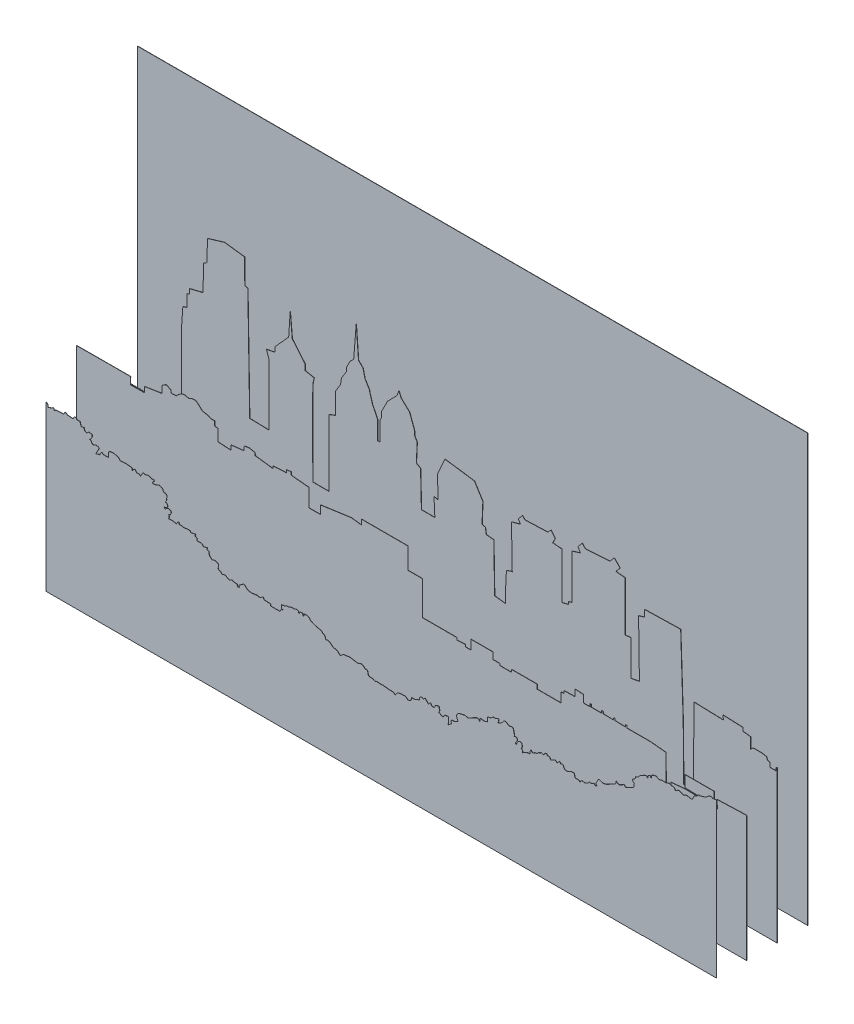
from build123d import *

# Parameters (mm, degrees)
SKETCH5_W           = 279.4
SKETCH5_H           = 177.800683396
BOSS_EXTRUDE1_DEPTH = 0.100000054
BOSS_EXTRUDE2_DEPTH = 0.100000054
BOSS_EXTRUDE3_DEPTH = 0.100000054
BOSS_EXTRUDE4_DEPTH = 0.100000054


with BuildPart() as part:
    # Sketch5 → Boss-Extrude1 (new body)
    with BuildSketch(Plane.XY):
        with Locations((139.7, -88.900341698)):
            Rectangle(SKETCH5_W, SKETCH5_H)
    extrude(amount=BOSS_EXTRUDE1_DEPTH)


with BuildPart() as body_2:
    # Sketch2 → Boss-Extrude2 (new body)
    with BuildSketch(Plane.XY.offset(12.7)):
        with BuildLine():
            Line((279.4, -114.534072706), (278.809769016, -114.829381985))
            Line((278.809769016, -114.829381985), (278.809769016, -115.882870653))
            Line((278.809769016, -115.882870653), (276.353092957, -115.882870653))
            Line((276.353092957, -115.882870653), (276.353092957, -114.127056207))
            Line((276.353092957, -114.127056207), (275.300250244, -113.775871785))
            Line((275.300250244, -113.775871785), (274.949302673, -112.72240465))
            Line((274.949302673, -112.72240465), (272.843574185, -112.371220228))
            Line((272.843574185, -112.371220228), (269.334120009, -112.371220228))
            Line((269.334120009, -112.371220228), (268.281255764, -113.424708896))
            Line((268.281255764, -113.424708896), (268.281255764, -108.859591336))
            Line((268.281255764, -108.859591336), (265.122684564, -108.508449978))
            Line((265.122684564, -108.508449978), (265.122684564, -107.103798421))
            Line((265.122684564, -107.103798421), (256.699899801, -106.752635532))
            Line((256.699899801, -106.752635532), (257.050847371, -108.508449978))
            Line((257.050847371, -108.508449978), (244.651388889, -108.126388889))
            Line((244.651388889, -108.126388889), (244.545559862, -139.876388889))
            Line((244.545559862, -139.876388889), (240.418055556, -140.088046943))
            Line((240.418055556, -140.088046943), (240.205256314, -117.28752221))
            Line((240.205256314, -117.28752221), (239.152413601, -84.629308912))
            Line((239.152413601, -84.629308912), (224.06158193, -84.98045027))
            Line((224.06158193, -84.98045027), (224.06158193, -87.789774916))
            Line((224.06158193, -87.789774916), (221.60490587, -88.492122226))
            Line((221.60490587, -88.492122226), (221.955853441, -112.020057339))
            Line((221.955853441, -112.020057339), (218.446334669, -112.72240465))
            Line((218.446334669, -112.72240465), (218.446334669, -97.973520237))
            Line((218.446334669, -97.973520237), (215.989744737, -98.324704658))
            Line((215.989744737, -98.324704658), (215.989744737, -77.606029595))
            Line((215.989744737, -77.606029595), (212.129256863, -77.254866706))
            Line((212.129256863, -77.254866706), (213.884016249, -75.147867839))
            Line((213.884016249, -75.147867839), (211.427361721, -72.689727614))
            Line((211.427361721, -72.689727614), (209.672623867, -74.796726481))
            Line((209.672623867, -74.796726481), (199.495058187, -75.499073792))
            Line((199.495058187, -75.499073792), (198.091289435, -74.094379171))
            Line((198.091289435, -74.094379171), (196.33653005, -76.201378038))
            Line((196.33653005, -76.201378038), (197.389394294, -77.957192485))
            Line((197.389394294, -77.957192485), (193.879897054, -79.010681152))
            Line((193.879897054, -79.010681152), (193.879897054, -97.622357347))
            Line((193.879897054, -97.622357347), (192.476085239, -97.973520237))
            Line((192.476085239, -97.973520237), (192.476085239, -99.027008904))
            Line((192.476085239, -99.027008904), (189.668504673, -99.729356215))
            Line((189.668504673, -99.729356215), (189.668504673, -80.415332709))
            Line((189.668504673, -80.415332709), (185.808059862, -80.064191352))
            Line((185.808059862, -80.064191352), (186.860881042, -77.957192485))
            Line((186.860881042, -77.957192485), (185.106121657, -75.850215149))
            Line((185.106121657, -75.850215149), (183.702309842, -77.254866706))
            Line((183.702309842, -77.254866706), (174.226682366, -77.606029595))
            Line((174.226682366, -77.606029595), (173.173839654, -76.552519396))
            Line((173.173839654, -76.552519396), (171.4191018, -78.659518263))
            Line((171.4191018, -78.659518263), (172.47192298, -80.064191352))
            Line((172.47192298, -80.064191352), (168.611499702, -81.117658488))
            add(Edge.make_bspline(
                [(168.611499702, -81.117658488), (168.816978116, -97.961354743), (168.947116597, -98.979897224)],
                knots=[50, 50, 50, 51, 51, 51], degree=2))
            add(Edge.make_bspline(
                [(168.947116597, -98.979897224), (168.731475152, -98.850275506), (166.505771213, -99.729356215)],
                knots=[53, 53, 53, 54, 54, 54], degree=2))
            add(Edge.make_bspline(
                [(166.505771213, -99.729356215), (165.865543281, -111.10168101), (166.115161981, -111.962158203)],
                knots=[54, 54, 54, 55, 55, 55], degree=2))
            add(Edge.make_bspline(
                [(166.115161981, -111.962158203), (165.591722785, -111.75622762), (161.592505222, -111.317753092)],
                knots=[57, 57, 57, 58, 58, 58], degree=2))
            Line((161.592505222, -111.317753092), (161.241514587, -91.30142534))
            Line((161.241514587, -91.30142534), (158.083007982, -90.950240919))
            Line((158.083007982, -90.950240919), (157.732060411, -88.492122226))
            Line((157.732060411, -88.492122226), (156.328248596, -88.140916273))
            Line((156.328248596, -88.140916273), (156.679153103, -79.713028463))
            Line((156.679153103, -79.713028463), (153.169720459, -74.094379171))
            Line((153.169720459, -74.094379171), (140.88642629, -72.338564724))
            Line((140.88642629, -72.338564724), (137.727855089, -79.361844042))
            Line((137.727855089, -79.361844042), (138.078845723, -88.492122226))
            Line((138.078845723, -88.492122226), (136.324086338, -88.140916273))
            Line((136.324086338, -88.140916273), (136.675033908, -95.515401544))
            Line((136.675033908, -95.515401544), (131.059829712, -95.515401544))
            Line((131.059829712, -95.515401544), (130.708882141, -80.766495599))
            Line((130.708882141, -80.766495599), (128.954144287, -79.713028463))
            Line((128.954144287, -79.713028463), (129.30511339, -71.987401835))
            Line((129.30511339, -71.987401835), (128.252249146, -70.231587389))
            Line((128.252249146, -70.231587389), (128.252249146, -68.475794474))
            Line((128.252249146, -68.475794474), (126.118012492, -62.723884583))
            Line((126.118012492, -62.723884583), (122.625546943, -59.443055556))
            Line((122.625546943, -59.443055556), (121.673042636, -57.220559862))
            Line((121.673042636, -57.220559862), (120.882307095, -59.34551629))
            Line((120.882307095, -59.34551629), (116.910521105, -63.464709303))
            Line((116.910521105, -63.464709303), (114.476388889, -68.227187771))
            Line((114.476388889, -68.227187771), (114.476388889, -70.449726529))
            Line((114.476388889, -70.449726529), (113.863291083, -71.636260478))
            Line((113.863291083, -71.636260478), (113.863291083, -79.713028463))
            Line((113.863291083, -79.713028463), (112.810426839, -79.713028463))
            Line((112.810426839, -79.713028463), (112.810426839, -71.987401835))
            Line((112.810426839, -71.987401835), (110.704741414, -67.773447164))
            Line((110.704741414, -67.773447164), (109.651898702, -64.261818271))
            Line((109.651898702, -64.261818271), (109.300929599, -62.85712365))
            Line((109.300929599, -62.85712365), (108.248086887, -61.101330736))
            Line((108.248086887, -61.101330736), (107.546213277, -60.0478636))
            Line((107.546213277, -60.0478636), (106.750525411, -56.585542636))
            Line((106.750525411, -56.585542636), (104.845559862, -54.680555556))
            Line((104.845559862, -54.680555556), (103.893055556, -42.086384583))
            Line((103.893055556, -42.086384583), (102.834679159, -55.315551249))
            Line((102.834679159, -55.315551249), (101.353008185, -56.691393195))
            Line((101.353008185, -56.691393195), (99.825323656, -59.696657647))
            Line((99.825323656, -59.696657647), (99.765508185, -61.348042636))
            Line((99.765508185, -61.348042636), (97.719616699, -64.61298116))
            Line((97.719616699, -64.61298116), (97.368647597, -67.071099854))
            Line((97.368647597, -67.071099854), (95.26294064, -70.582750278))
            Line((95.26294064, -70.582750278), (95.26294064, -73.040912035))
            Line((95.26294064, -73.040912035), (95.26294064, -79.361844042))
            Line((95.26294064, -79.361844042), (92.455360074, -80.415332709))
            Line((92.455360074, -80.415332709), (92.455360074, -108.157287089))
            Line((92.455360074, -108.157287089), (85.787291633, -108.157287089))
            add(Edge.make_bspline(
                [(85.787291633, -108.157287089), (85.653428141, -74.303453403), (85.787291633, -73.040912035)],
                knots=[106, 106, 106, 107, 107, 107], degree=2))
            add(Edge.make_bspline(
                [(85.787291633, -73.040912035), (85.911465793, -71.869902547), (86.435981581, -70.254626465), (86.324726529, -70.238046943)],
                knots=[107, 107, 107, 107, 108, 108, 108, 108], degree=3))
            Line((86.324726529, -70.238046943), (82.628741964, -69.52926161))
            Line((82.628741964, -69.52926161), (82.620559862, -67.16887597))
            Line((82.620559862, -67.16887597), (77.223021105, -60.713046943))
            Line((77.223021105, -60.713046943), (76.376388889, -51.188046943))
            Line((76.376388889, -51.188046943), (75.741350132, -60.81887597))
            Line((75.741350132, -60.81887597), (70.026388889, -67.16887597))
            Line((70.026388889, -67.16887597), (69.920559862, -69.179713609))
            Line((69.920559862, -69.179713609), (66.485067579, -69.880402968))
            Line((66.485067579, -69.880402968), (67.537931824, -73.040912035))
            add(Edge.make_bspline(
                [(67.537931824, -73.040912035), (67.583923848, -96.829856194), (67.556944444, -98.513194444)],
                knots=[117, 117, 117, 118, 118, 118], degree=2))
            add(Edge.make_bspline(
                [(67.556944444, -98.513194444), (67.567753432, -98.538149855), (59.466094632, -98.324704658)],
                knots=[118, 118, 118, 119, 119, 119], degree=2))
            Line((59.466094632, -98.324704658), (58.702187771, -51.717213609))
            Line((58.702187771, -51.717213609), (57.432217916, -51.399726529))
            Line((57.432217916, -51.399726529), (57.360366143, -41.084981452))
            Line((57.360366143, -41.084981452), (48.93758138, -40.031492784))
            Line((48.93758138, -40.031492784), (41.918565369, -42.138491652))
            Line((41.918565369, -42.138491652), (41.567617798, -51.268726773))
            Line((41.567617798, -51.268726773), (40.181354438, -51.823042636))
            Line((40.181354438, -51.823042636), (40.075525411, -62.618055556))
            Line((40.075525411, -62.618055556), (34.466350132, -63.99387597))
            Line((34.466350132, -63.99387597), (34.466350132, -66.004713609))
            Line((34.466350132, -66.004713609), (33.302187771, -66.428051249))
            Line((33.302187771, -66.428051249), (33.408059862, -71.402209303))
            Line((33.408059862, -71.402209303), (31.608858744, -71.825546943))
            Line((31.608858744, -71.825546943), (31.039126078, -80.064191352))
            Line((31.039126078, -80.064191352), (31.039126078, -110.966590203))
            Line((31.039126078, -110.966590203), (0, -110.470216539))
            Line((0, -110.470216539), (0, -177.800667487))
            Line((0, -177.800667487), (279.4, -177.800667487))
            Line((279.4, -177.800667487), (279.4, -114.534072706))
        make_face()
    extrude(amount=BOSS_EXTRUDE2_DEPTH)


with BuildPart() as body_3:
    # Sketch3 → Boss-Extrude3 (new body)
    with BuildSketch(Plane.XY.offset(25.4)):
        with BuildLine():
            Line((279.4, -125.43814443), (278.729713609, -125.377209303))
            Line((278.729713609, -125.377209303), (266.982217916, -125.800546943))
            Line((266.982217916, -125.800546943), (267.193854438, -129.187226529))
            Line((267.193854438, -129.187226529), (261.478850132, -128.975546943))
            Line((261.478850132, -128.975546943), (261.478850132, -128.446380276))
            Line((261.478850132, -128.446380276), (265.818012492, -128.340551249))
            Line((265.818012492, -128.340551249), (265.818012492, -123.472222222))
            Line((265.818012492, -123.472222222), (253.753008185, -123.472222222))
            Line((253.753008185, -123.472222222), (253.753008185, -128.234722222))
            Line((253.753008185, -128.234722222), (258.938888889, -128.340551249))
            Line((258.938888889, -128.340551249), (258.83303833, -128.763888889))
            Line((258.83303833, -128.763888889), (253.647179159, -128.658059862))
            Line((253.647179159, -128.658059862), (247.826388889, -129.187226529))
            Line((247.826388889, -129.187226529), (247.826388889, -141.675546943))
            Line((247.826388889, -141.675546943), (245.815508185, -140.828893195))
            Line((245.815508185, -140.828893195), (245.709679159, -119.450546943))
            Line((245.709679159, -119.450546943), (239.465508185, -118.815551249))
            Line((239.465508185, -118.815551249), (229.411341519, -118.815551249))
            Line((229.411341519, -118.815551249), (229.411341519, -117.863046943))
            Line((229.411341519, -117.863046943), (228.776345825, -117.863046943))
            Line((228.776345825, -117.863046943), (228.776345825, -118.709679159))
            Line((228.776345825, -118.709679159), (224.437226529, -118.603893195))
            Line((224.437226529, -118.603893195), (224.437226529, -117.863046943))
            Line((224.437226529, -117.863046943), (223.908059862, -117.863046943))
            Line((223.908059862, -117.863046943), (223.908059862, -118.709679159))
            Line((223.908059862, -118.709679159), (219.56887597, -118.603893195))
            Line((219.56887597, -118.603893195), (219.56887597, -117.757174852))
            Line((219.56887597, -117.757174852), (218.828008185, -117.757174852))
            Line((218.828008185, -117.757174852), (218.828008185, -118.709679159))
            Line((218.828008185, -118.709679159), (214.488888889, -118.709679159))
            Line((214.488888889, -118.709679159), (214.488888889, -117.651388889))
            Line((214.488888889, -117.651388889), (214.065508185, -117.651388889))
            Line((214.065508185, -117.651388889), (214.065508185, -118.815551249))
            Line((214.065508185, -118.815551249), (211.313845825, -118.815551249))
            Line((211.313845825, -118.815551249), (211.313845825, -115.746380276))
            Line((211.313845825, -115.746380276), (207.821358744, -115.534722222))
            Line((207.821358744, -115.534722222), (207.821358744, -118.286384583))
            Line((207.821358744, -118.286384583), (203.270559862, -118.392213609))
            Line((203.270559862, -118.392213609), (203.270559862, -119.450546943))
            Line((203.270559862, -119.450546943), (202.000546943, -119.450546943))
            Line((202.000546943, -119.450546943), (202.000546943, -123.472222222))
            Line((202.000546943, -123.472222222), (192.052187771, -123.472222222))
            Line((192.052187771, -123.472222222), (192.052187771, -121.673042636))
            Line((192.052187771, -121.673042636), (181.363046943, -121.673042636))
            Line((181.363046943, -121.673042636), (181.363046943, -122.73137597))
            Line((181.363046943, -122.73137597), (176.494674852, -122.73137597))
            Line((176.494674852, -122.73137597), (176.494674852, -121.990551249))
            Line((176.494674852, -121.990551249), (173.53137597, -121.990551249))
            Line((173.53137597, -121.990551249), (173.53137597, -119.238888889))
            Line((173.53137597, -119.238888889), (164.429692078, -119.238888889))
            Line((164.429692078, -119.238888889), (164.429692078, -123.154713609))
            Line((164.429692078, -123.154713609), (162.207217916, -123.154713609))
            Line((162.207217916, -123.154713609), (161.995559862, -122.308059862))
            Line((161.995559862, -122.308059862), (158.608858744, -122.519717916))
            Line((158.608858744, -122.519717916), (158.608858744, -121.567213609))
            Line((158.608858744, -121.567213609), (150.565508185, -121.567213609))
            Line((150.565508185, -121.567213609), (144.215508185, -121.567213609))
            Line((144.215508185, -121.567213609), (144.215508185, -107.491393195))
            Line((144.215508185, -107.491393195), (138.183059862, -107.491393195))
            Line((138.183059862, -107.491393195), (138.183059862, -98.707217916))
            Line((138.183059862, -98.707217916), (135.219717916, -98.707217916))
            Line((135.219717916, -98.707217916), (118.709679159, -98.707217916))
            Line((118.709679159, -98.707217916), (118.709679159, -100.823884583))
            Line((118.709679159, -100.823884583), (114.582217916, -100.294717916))
            Line((114.582217916, -100.294717916), (101.776388889, -102.09387597))
            Line((101.776388889, -102.09387597), (101.776388889, -105.586384583))
            Line((101.776388889, -105.586384583), (96.802187771, -105.586384583))
            Line((96.802187771, -105.586384583), (96.802187771, -98.178051249))
            Line((96.802187771, -98.178051249), (89.817192078, -97.543055556))
            Line((89.817192078, -97.543055556), (89.499683465, -97.437226529))
            Line((89.499683465, -97.437226529), (89.499683465, -96.273042636))
            Line((89.499683465, -96.273042636), (87.488888889, -96.484679159))
            Line((87.488888889, -96.484679159), (87.488888889, -97.648884583))
            Line((87.488888889, -97.648884583), (86.642213609, -97.648884583))
            Line((86.642213609, -97.648884583), (81.985521105, -97.966393195))
            Line((81.985521105, -97.966393195), (81.985521105, -98.91887597))
            Line((81.985521105, -98.91887597), (74.471358744, -97.966393195))
            Line((74.471358744, -97.966393195), (74.365508185, -96.908059862))
            Line((74.365508185, -96.908059862), (72.037183465, -96.378893195))
            Line((72.037183465, -96.378893195), (69.920559862, -96.696380276))
            Line((69.920559862, -96.696380276), (69.814687771, -98.495559862))
            Line((69.814687771, -98.495559862), (64.311341519, -99.130555556))
            Line((64.311341519, -99.130555556), (64.311341519, -101.035542636))
            Line((64.311341519, -101.035542636), (58.913888889, -100.718055556))
            Line((58.913888889, -100.718055556), (58.913888889, -95.955555556))
            Line((58.913888889, -95.955555556), (57.538025411, -95.638046943))
            Line((57.538025411, -95.638046943), (57.538025411, -93.838888889))
            Line((57.538025411, -93.838888889), (55.844674852, -93.838888889))
            Line((55.844674852, -93.838888889), (54.680512492, -93.203893195))
            add(Edge.make_bspline(
                [(54.680512492, -93.203893195), (53.317525058, -93.135055881), (52.458059862, -92.780555556)],
                knots=[89, 89, 89, 90, 90, 90], degree=2))
            add(Edge.make_bspline(
                [(52.458059862, -92.780555556), (51.598551602, -92.426012166), (50.476634725, -90.450206841), (49.177187771, -90.452209303)],
                knots=[90, 90, 90, 90, 91, 91, 91, 91], degree=3))
            add(Edge.make_bspline(
                [(49.177187771, -90.452209303), (47.877762349, -90.454190233), (46.848863051, -91.087226529)],
                knots=[91, 91, 91, 92, 92, 92], degree=2))
            add(Edge.make_bspline(
                [(46.848863051, -91.087226529), (46.5743966, -91.074587335), (45.155512492, -90.769717916)],
                knots=[92, 92, 92, 93, 93, 93], degree=2))
            add(Edge.make_bspline(
                [(45.155512492, -90.769717916), (43.73669298, -90.464805433), (41.557217916, -92.780555556)],
                knots=[93, 93, 93, 94, 94, 94], degree=2))
            Line((41.557217916, -92.780555556), (39.334679159, -92.886384583))
            Line((39.334679159, -92.886384583), (39.334679159, -91.828051249))
            Line((39.334679159, -91.828051249), (37.323863051, -90.875546943))
            Line((37.323863051, -90.875546943), (35.524726529, -92.039709303))
            Line((35.524726529, -92.039709303), (35.524726529, -94.897222222))
            Line((35.524726529, -94.897222222), (28.222179159, -96.061384583))
            Line((28.222179159, -96.061384583), (28.222179159, -98.283880276))
            add(Edge.make_bspline(
                [(28.222179159, -98.283880276), (25.840024821, -98.310063002), (22.4437205, -98.347377692)],
                knots=[101, 101, 101, 102, 102, 102], degree=2))
            add(Edge.make_bspline(
                [(22.4437205, -98.347377692), (22.394111125, -97.994320001), (22.507217916, -95.320559862)],
                knots=[102, 102, 102, 103, 103, 103], degree=2))
            Line((22.507217916, -95.320559862), (0, -95.423331367))
            Line((0, -95.423331367), (0, -177.800667487))
            Line((0, -177.800667487), (279.4, -177.800667487))
            Line((279.4, -177.800667487), (279.4, -125.43814443))
        make_face()
    extrude(amount=BOSS_EXTRUDE3_DEPTH)


with BuildPart() as body_4:
    # Sketch4 → Boss-Extrude4 (new body)
    with BuildSketch(Plane.XY.offset(38.1)):
        with BuildLine():
            add(Edge.make_bspline(
                [(277.653517456, -113.416647911), (277.848880208, -113.539517914), (278.126899414, -113.597925202), (278.359520874, -113.578950666), (278.710300496, -113.550341705), (279.053561198, -113.429271091), (279.4, -113.347500404)],
                knots=[344, 344, 344, 344, 345, 345, 345, 346, 346, 346, 346], degree=3))
            add(Edge.make_bspline(
                [(279.4, -113.347500404), (279.4, -134.796389427), (279.4, -156.245278854), (279.4, -177.694166667)],
                knots=[0, 0, 0, 0, 1, 1, 1, 1], degree=3))
            add(Edge.make_bspline(
                [(279.4, -177.694166667), (269.258086751, -177.693520711), (259.116147664, -177.69238383), (248.974234416, -177.696718191), (248.815019328, -177.696789246), (248.655855916, -177.76407842), (248.496666667, -177.8)],
                knots=[1, 1, 1, 1, 2, 2, 2, 3, 3, 3, 3], degree=3))
            add(Edge.make_bspline(
                [(248.496666667, -177.8), (165.664448751, -177.8), (82.832224375, -177.8), (1.3e-08, -177.8)],
                knots=[3, 3, 3, 3, 4, 4, 4, 4], degree=3))
            add(Edge.make_bspline(
                [(1.3e-08, -177.8), (0, -155.045833333), (0, -132.291666667), (0, -109.5375)],
                knots=[4, 4, 4, 4, 5, 5, 5, 5], degree=3))
            add(Edge.make_bspline(
                [(0, -109.5375), (0.945892482, -109.619166426), (0.64657436, -110.502392856), (0.911710137, -111.013310475)],
                knots=[5, 5, 5, 5, 6, 6, 6, 6], degree=3))
            add(Edge.make_bspline(
                [(0.911710137, -111.013310475), (1.467223306, -110.621761176), (2.2165019, -110.697108644), (2.665994207, -110.132220542), (2.751055028, -110.025322493), (3.048488827, -110.087413846), (3.240831334, -110.072095922)],
                knots=[6, 6, 6, 6, 7, 7, 7, 8, 8, 8, 8], degree=3))
            add(Edge.make_bspline(
                [(3.240831334, -110.072095922), (3.279755799, -110.345598789), (3.310129833, -110.559022152), (3.345007388, -110.804087942)],
                knots=[8, 8, 8, 8, 9, 9, 9, 9], degree=3))
            add(Edge.make_bspline(
                [(3.345007388, -110.804087942), (3.736475741, -110.60712968), (4.049865446, -110.335045695), (4.387172861, -110.301179363), (5.402626464, -110.199225396), (6.427393532, -110.190026486), (7.435388368, -110.145235232)],
                knots=[9, 9, 9, 9, 10, 10, 10, 11, 11, 11, 11], degree=3))
            add(Edge.make_bspline(
                [(7.435388368, -110.145235232), (7.51900568, -109.891243044), (7.56920126, -109.730396818), (7.624834169, -109.571453636), (7.759244569, -109.187441299), (8.13810468, -109.053354003), (8.413887266, -109.349453248), (8.753656578, -109.714252071), (9.145411574, -109.764308063), (9.597901719, -109.758780603), (9.940699755, -109.754593096), (10.290496718, -109.790994197), (10.626079432, -109.861878618), (11.055984554, -109.952686625), (11.309597143, -109.832838784), (11.439029649, -109.399266603), (11.492830467, -109.219043204), (11.64180474, -109.067231572), (11.7475, -108.902500013)],
                knots=[11, 11, 11, 11, 12, 12, 12, 13, 13, 13, 14, 14, 14, 15, 15, 15, 16, 16, 16, 17, 17, 17, 17], degree=3))
            add(Edge.make_bspline(
                [(11.7475, -108.902500013), (12.029721953, -108.9025), (12.311944714, -108.9025), (12.594166667, -108.9025)],
                knots=[17, 17, 17, 17, 18, 18, 18, 18], degree=3))
            add(Edge.make_bspline(
                [(12.594166667, -108.9025), (12.876322409, -109.813623428), (13.552462502, -109.441066832), (14.096192233, -109.298054677)],
                knots=[18, 18, 18, 18, 19, 19, 19, 19], degree=3))
            add(Edge.make_bspline(
                [(14.096192233, -109.298054677), (14.247190768, -109.858442942), (14.358380686, -110.342903742), (14.520607541, -110.809622973), (14.551275889, -110.897854425), (14.790224482, -110.968663855), (14.923612658, -110.955025717), (15.22167263, -110.924551156), (15.513770434, -110.835754089), (15.898417498, -110.750814184)],
                knots=[19, 19, 19, 19, 20, 20, 20, 21, 21, 21, 22, 22, 22, 22], degree=3))
            add(Edge.make_bspline(
                [(15.898417498, -110.750814184), (15.722011922, -111.514133023), (16.120899073, -111.933184277), (16.631003596, -112.111042647), (17.240992203, -112.323728511), (17.452770297, -111.601831764), (17.750801201, -111.42977488)],
                knots=[22, 22, 22, 22, 23, 23, 23, 24, 24, 24, 24], degree=3))
            add(Edge.make_bspline(
                [(17.750801201, -111.42977488), (18.324971581, -111.497957088), (18.776785088, -111.55160974), (19.267005488, -111.609823241)],
                knots=[24, 24, 24, 24, 25, 25, 25, 25], degree=3))
            add(Edge.make_bspline(
                [(19.267005488, -111.609823241), (19.193486074, -112.050277219), (19.212557907, -112.535320489), (19.020683314, -112.913271418), (18.836883163, -113.275313676), (18.434033076, -113.526149464), (18.073998528, -113.878118451)],
                knots=[25, 25, 25, 25, 26, 26, 26, 27, 27, 27, 27], degree=3))
            add(Edge.make_bspline(
                [(18.073998528, -113.878118451), (18.733045832, -113.775393778), (18.753529078, -114.341444095), (18.996225828, -114.642506549), (19.326872635, -115.052666833), (19.677584432, -115.164167213), (20.089921989, -114.891341085), (20.633183403, -114.531885475), (21.605310758, -114.623983777), (22.13396066, -115.102279437)],
                knots=[27, 27, 27, 27, 28, 28, 28, 29, 29, 29, 30, 30, 30, 30], degree=3))
            add(Edge.make_bspline(
                [(22.13396066, -115.102279437), (21.666395531, -115.957094428), (21.195640996, -116.817738762), (20.688905131, -117.744164772)],
                knots=[30, 30, 30, 30, 31, 31, 31, 31], degree=3))
            add(Edge.make_bspline(
                [(20.688905131, -117.744164772), (21.27576369, -117.593410085), (21.834665298, -117.449836), (22.438919436, -117.294612109)],
                knots=[31, 31, 31, 31, 32, 32, 32, 32], degree=3))
            add(Edge.make_bspline(
                [(22.438919436, -117.294612109), (22.438919436, -117.178051879), (22.39135128, -117.015129814), (22.448398832, -116.907829355), (22.585281626, -116.650366065), (22.735416196, -116.379689757), (22.946556409, -116.187086849), (23.210870056, -115.945979958), (23.397326698, -116.210739314), (23.616354027, -116.362515418), (23.782963689, -116.477968642), (24.030561625, -116.509551824), (24.244376094, -116.517436517), (24.79556338, -116.537763119), (25.347998975, -116.524240042), (25.931114222, -116.524240042)],
                knots=[32, 32, 32, 32, 33, 33, 33, 34, 34, 34, 35, 35, 35, 36, 36, 36, 37, 37, 37, 37], degree=3))
            add(Edge.make_bspline(
                [(25.931114222, -116.524240042), (25.931114222, -116.149254856), (25.931089999, -115.727225545), (25.931120682, -115.305196234), (25.931172358, -114.578339761), (26.178783213, -114.133746421), (26.903097852, -114.000641254), (27.535224965, -113.884477479), (28.250594737, -113.842743915), (28.849388936, -114.027188002), (29.484162852, -114.222713858), (30.269360402, -114.284857998), (30.657114512, -115.027370008), (30.730065486, -115.167062305), (31.056941528, -115.270221383), (31.241691233, -115.239619246), (32.313221436, -115.062130887), (33.383782705, -115.022496274), (34.460642039, -115.150127373), (34.932147497, -115.206011397), (35.401708628, -115.278361228), (35.85055397, -115.340255464)],
                knots=[37, 37, 37, 37, 38, 38, 38, 39, 39, 39, 40, 40, 40, 41, 41, 41, 42, 42, 42, 43, 43, 43, 44, 44, 44, 44], degree=3))
            add(Edge.make_bspline(
                [(35.85055397, -115.340255464), (35.873672714, -115.728704783), (35.890609665, -116.013248138), (35.907546616, -116.297791494)],
                knots=[44, 44, 44, 44, 45, 45, 45, 45], degree=3))
            add(Edge.make_bspline(
                [(35.907546616, -116.297791494), (36.13343399, -116.096934891), (36.250125834, -115.876504224), (36.3692497, -115.657396959), (36.555549698, -115.31472771), (36.931905924, -115.234397504), (37.222715047, -115.494991255), (37.362377065, -115.620143096), (37.451799901, -115.799972235), (37.584989446, -115.934184812), (37.69052887, -116.04053168), (37.88837532, -116.218891271), (37.942089742, -116.187692432), (38.467800547, -115.882351735), (38.883059438, -116.148121204), (39.372822825, -116.526582438)],
                knots=[45, 45, 45, 45, 46, 46, 46, 47, 47, 47, 48, 48, 48, 49, 49, 49, 50, 50, 50, 50], degree=3))
            add(Edge.make_bspline(
                [(39.372822825, -116.526582438), (39.707437414, -115.942420743), (40.004253922, -115.424245008), (40.355020625, -114.811882919)],
                knots=[50, 50, 50, 50, 51, 51, 51, 51], degree=3))
            add(Edge.make_bspline(
                [(40.355020625, -114.811882919), (40.493881658, -114.846507339), (40.771248449, -114.948057585), (41.056017888, -114.977179273), (41.318492177, -115.004020335), (41.640174739, -115.040132472), (41.84569514, -114.919141795), (42.349104335, -114.622779878), (42.774776026, -114.645258319), (43.283879318, -114.916359342), (43.595194295, -115.082139355), (44.011218643, -115.153498453), (44.36337738, -115.114648272), (44.808980026, -115.065490259), (45.022090403, -115.236972443), (45.21709465, -115.627737916)],
                knots=[51, 51, 51, 51, 52, 52, 52, 53, 53, 53, 54, 54, 54, 55, 55, 55, 56, 56, 56, 56], degree=3))
            add(Edge.make_bspline(
                [(45.21709465, -115.627737916), (44.609140803, -115.688548965), (44.441621958, -116.096431046), (44.351859996, -116.678159911)],
                knots=[56, 56, 56, 56, 57, 57, 57, 57], degree=3))
            add(Edge.make_bspline(
                [(44.351859996, -116.678159911), (44.812616755, -116.617038803), (45.24954099, -116.605028877), (45.658362935, -116.491670163), (46.051662572, -116.38261432), (46.406440659, -116.141313642), (46.795086187, -116.007226219), (47.394791183, -115.800323474), (48.368210449, -116.247219645), (48.674076792, -116.862514776), (48.901304525, -117.319620272), (49.084481328, -117.724155496), (49.757938283, -117.60730943), (50.176339747, -117.53471777), (50.577484512, -118.463796234), (50.332954865, -118.84063935)],
                knots=[57, 57, 57, 57, 58, 58, 58, 59, 59, 59, 60, 60, 60, 61, 61, 61, 62, 62, 62, 62], degree=3))
            add(Edge.make_bspline(
                [(50.332954865, -118.84063935), (50.196558151, -119.050846157), (50.079162216, -119.218159103), (50.23987915, -119.510600071)],
                knots=[62, 62, 62, 62, 63, 63, 63, 63], degree=3))
            add(Edge.make_bspline(
                [(50.23987915, -119.510600071), (50.318068822, -119.652862867), (50.154771296, -119.950954329), (50.058569158, -120.158978615), (49.974717687, -120.340292645), (49.831577199, -120.494187482), (49.676228155, -120.714717464)],
                knots=[63, 63, 63, 63, 64, 64, 64, 65, 65, 65, 65], degree=3))
            add(Edge.make_bspline(
                [(49.676228155, -120.714717464), (50.376130524, -120.856958459), (50.731154073, -121.339981302), (50.651078211, -121.899615262), (50.558906835, -122.543795904), (49.914650294, -122.649149615), (49.167208837, -122.680696462)],
                knots=[65, 65, 65, 65, 66, 66, 66, 67, 67, 67, 67], degree=3))
            add(Edge.make_bspline(
                [(49.167208837, -122.680696462), (49.322128321, -122.945678673), (49.386859512, -123.193278224), (49.536734085, -123.266426214), (49.64327151, -123.318420779), (49.964811961, -123.176572202), (50.017047145, -123.049805069), (50.226863149, -122.540637182), (50.696660055, -122.520378405), (51.093715922, -122.485566254), (51.38749644, -122.459807167), (51.754618734, -122.597494176), (51.986613617, -122.787474505), (52.130332235, -122.905165965), (52.147165833, -123.269181213), (52.103415273, -123.500379957)],
                knots=[67, 67, 67, 67, 68, 68, 68, 69, 69, 69, 70, 70, 70, 71, 71, 71, 72, 72, 72, 72], degree=3))
            add(Edge.make_bspline(
                [(52.103415273, -123.500379957), (52.053108266, -123.766203524), (51.873057887, -124.007472712), (51.706214066, -124.347285627)],
                knots=[72, 72, 72, 72, 73, 73, 73, 73], degree=3))
            add(Edge.make_bspline(
                [(51.706214066, -124.347285627), (51.587258148, -124.383433291), (51.349785563, -124.455596199), (51.062616399, -124.542859929)],
                knots=[73, 73, 73, 73, 74, 74, 74, 74], degree=3))
            add(Edge.make_bspline(
                [(51.062616399, -124.542859929), (51.305482712, -125.057894707), (51.571399943, -125.553306974), (50.963110199, -126.031598193)],
                knots=[74, 74, 74, 74, 75, 75, 75, 75], degree=3))
            add(Edge.make_bspline(
                [(50.963110199, -126.031598193), (51.507657064, -126.034971695), (51.9603523, -125.921409505), (52.399857127, -125.959604848), (53.071912359, -126.018013751), (53.734872538, -126.181133639), (54.40083964, -126.299650307)],
                knots=[75, 75, 75, 75, 76, 76, 76, 77, 77, 77, 77], degree=3))
            add(Edge.make_bspline(
                [(54.40083964, -126.299650307), (54.905156403, -125.172243347), (54.905156403, -125.172243347), (55.460568237, -125.277317683)],
                knots=[77, 77, 77, 77, 78, 78, 78, 78], degree=3))
            add(Edge.make_bspline(
                [(55.460568237, -125.277317683), (55.460568237, -125.4762994), (55.460568237, -125.682223523), (55.460568237, -125.944284401)],
                knots=[78, 78, 78, 78, 79, 79, 79, 79], degree=3))
            add(Edge.make_bspline(
                [(55.460568237, -125.944284401), (55.895192871, -125.944284401), (56.338505605, -125.834975828), (56.687961019, -125.969487966), (57.234271342, -126.179773903), (57.671964264, -126.168816884), (58.23966863, -125.983771655), (58.794763947, -125.802833087), (59.454994965, -125.944400673), (60.085596008, -125.944400673)],
                knots=[79, 79, 79, 79, 80, 80, 80, 81, 81, 81, 82, 82, 82, 82], degree=3))
            add(Edge.make_bspline(
                [(60.085596008, -125.944400673), (60.10599528, -126.139810257), (60.121950378, -126.292704671), (60.142375488, -126.488374252)],
                knots=[82, 82, 82, 82, 83, 83, 83, 83], degree=3))
            add(Edge.make_bspline(
                [(60.142375488, -126.488374252), (60.831577606, -126.350243149), (61.503332469, -126.215608279), (62.303671214, -126.055203018)],
                knots=[83, 83, 83, 83, 84, 84, 84, 84], degree=3))
            add(Edge.make_bspline(
                [(62.303671214, -126.055203018), (62.192166392, -126.374489085), (62.117946116, -126.514031601), (62.101577606, -126.660062739)],
                knots=[84, 84, 84, 84, 85, 85, 85, 85], degree=3))
            add(Edge.make_bspline(
                [(62.101577606, -126.660062739), (62.091016235, -126.754249496), (62.141923981, -126.925243581), (62.205104879, -126.947193146), (63.026450094, -127.232519722), (63.02824585, -127.227344004), (62.856059977, -128.092032827)],
                knots=[85, 85, 85, 85, 86, 86, 86, 87, 87, 87, 87], degree=3))
            add(Edge.make_bspline(
                [(62.856059977, -128.092032827), (63.205231171, -128.092032827), (63.541935425, -128.142091141), (63.85762029, -128.081899401), (64.576329651, -127.944863192), (65.081918945, -128.05055603), (65.29448349, -128.550804888)],
                knots=[87, 87, 87, 87, 88, 88, 88, 89, 89, 89, 89], degree=3))
            add(Edge.make_bspline(
                [(65.29448349, -128.550804888), (65.512751821, -129.064499308), (65.790260722, -128.901363271), (66.145897929, -128.759765002), (66.432185364, -128.645778097), (66.752475891, -128.617210719), (67.105684306, -128.540291964)],
                knots=[89, 89, 89, 89, 90, 90, 90, 91, 91, 91, 91], degree=3))
            add(Edge.make_bspline(
                [(67.105684306, -128.540291964), (67.088585866, -128.882015292), (67.077875926, -129.096194725), (67.067340393, -129.30686985)],
                knots=[91, 91, 91, 91, 92, 92, 92, 92], degree=3))
            add(Edge.make_bspline(
                [(67.067340393, -129.30686985), (67.40487147, -129.397563604), (67.986399282, -129.136520106), (67.924529673, -129.769916522)],
                knots=[92, 92, 92, 92, 93, 93, 93, 93], degree=3))
            add(Edge.make_bspline(
                [(67.924529673, -129.769916522), (67.850819702, -130.524670194), (68.054554036, -131.073454526), (68.725921326, -131.434780986), (68.740746002, -131.442758535), (68.752767232, -131.458033765), (68.762992706, -131.472152735), (69.034319814, -131.84664861), (69.351865031, -131.808739103), (69.730252787, -131.62917319), (69.92749527, -131.535569407), (70.194481557, -131.481995481), (70.399378611, -131.53306633), (70.870047557, -131.650373446), (71.321977336, -131.84288915), (71.844826558, -132.027196376)],
                knots=[93, 93, 93, 93, 94, 94, 94, 95, 95, 95, 96, 96, 96, 97, 97, 97, 98, 98, 98, 98], degree=3))
            add(Edge.make_bspline(
                [(71.844826558, -132.027196376), (71.750807749, -132.425261548), (72.077577209, -132.980364939), (71.614446564, -133.459374784)],
                knots=[98, 98, 98, 98, 99, 99, 99, 99], degree=3))
            add(Edge.make_bspline(
                [(71.614446564, -133.459374784), (71.766556142, -133.868584302), (71.903879801, -134.338931885), (72.557476858, -134.211113459), (72.628829091, -134.197160823), (72.734410502, -134.345998637), (72.820710144, -134.423137016), (73.059061228, -134.636197332), (73.147576497, -135.167673289), (73.613187612, -134.91780482)],
                knots=[99, 99, 99, 99, 100, 100, 100, 101, 101, 101, 102, 102, 102, 102], degree=3))
            add(Edge.make_bspline(
                [(73.613187612, -134.91780482), (74.185529938, -134.61066433), (74.694097087, -134.595689468), (75.245174561, -134.995949275)],
                knots=[102, 102, 102, 102, 103, 103, 103, 103], degree=3))
            add(Edge.make_bspline(
                [(75.245174561, -134.995949275), (76.087293701, -135.607588298), (76.347910868, -135.604757398), (77.185469564, -135.084580816), (77.33746933, -134.990180893), (77.695315704, -134.967351214), (77.77619578, -135.063897324), (78.103591817, -135.454692268), (78.515020192, -135.354649925), (78.914989319, -135.361963755), (79.157306569, -135.366395009), (79.39976593, -135.362780889), (79.661746063, -135.362780889)],
                knots=[103, 103, 103, 103, 104, 104, 104, 105, 105, 105, 106, 106, 106, 107, 107, 107, 107], degree=3))
            add(Edge.make_bspline(
                [(79.661746063, -135.362780889), (79.683314514, -135.666943525), (79.701375427, -135.921684113), (79.720495707, -136.191396332)],
                knots=[107, 107, 107, 107, 108, 108, 108, 108], degree=3))
            add(Edge.make_bspline(
                [(79.720495707, -136.191396332), (80.030651194, -136.191396332), (80.308256989, -136.191396332), (80.593220215, -136.191396332)],
                knots=[108, 108, 108, 108, 109, 109, 109, 109], degree=3))
            add(Edge.make_bspline(
                [(80.593220215, -136.191396332), (80.537319234, -135.85864694), (80.483911641, -135.540756137), (80.452124176, -135.351552569)],
                knots=[109, 109, 109, 109, 110, 110, 110, 110], degree=3))
            add(Edge.make_bspline(
                [(80.452124176, -135.351552569), (80.988745168, -134.964263547), (81.466907196, -134.646619822), (81.912739156, -134.288695933), (82.269332377, -134.002414958), (82.720183411, -134.026273321), (83.003040822, -134.370473887), (83.486596578, -134.958900503), (84.02350825, -135.427014694), (84.859665222, -135.488692131), (85.363814036, -135.525879784), (85.821156921, -135.677703527), (86.359354045, -135.496771418), (86.91895167, -135.308643366), (87.550075938, -135.33184447), (88.150594838, -135.269022077), (88.211818492, -135.262619044), (88.283035075, -135.289403585), (88.340434672, -135.318746109), (88.805244802, -135.556344655), (89.546969554, -135.421557986), (89.888679962, -135.033414688), (90.386085002, -134.46841526), (90.479425557, -134.486258163), (90.780492452, -135.209350332)],
                knots=[110, 110, 110, 110, 111, 111, 111, 112, 112, 112, 113, 113, 113, 114, 114, 114, 115, 115, 115, 116, 116, 116, 117, 117, 117, 118, 118, 118, 118], degree=3))
            add(Edge.make_bspline(
                [(90.780492452, -135.209350332), (90.812150726, -135.285369593), (90.827143351, -135.368324801), (90.842678579, -135.422822444)],
                knots=[118, 118, 118, 118, 119, 119, 119, 119], degree=3))
            add(Edge.make_bspline(
                [(90.842678579, -135.422822444), (91.532765656, -135.474794401), (92.195819499, -135.577176717), (92.855398102, -135.558251839), (93.409963735, -135.542340342), (93.65105367, -135.699325269), (93.563371684, -136.264321467), (93.55704778, -136.305065104), (93.599403076, -136.353366419), (93.58225942, -136.314434687)],
                knots=[119, 119, 119, 119, 120, 120, 120, 121, 121, 121, 122, 122, 122, 122], degree=3))
            add(Edge.make_bspline(
                [(93.58225942, -136.314434687), (94.875294189, -136.314434687), (96.119132996, -136.328858871), (97.361686351, -136.295240122), (97.508518473, -136.291267497), (97.753581034, -136.035756607), (97.771415863, -135.876505992)],
                knots=[122, 122, 122, 122, 123, 123, 123, 124, 124, 124, 124], degree=3))
            add(Edge.make_bspline(
                [(97.771415863, -135.876505992), (97.823944956, -135.407355042), (98.05665685, -135.239598808), (98.494052633, -135.252041524), (98.576256917, -135.254379883), (98.660056712, -135.200544345), (98.79174764, -135.15629317)],
                knots=[124, 124, 124, 124, 125, 125, 125, 126, 126, 126, 126], degree=3))
            add(Edge.make_bspline(
                [(98.79174764, -135.15629317), (98.090466156, -134.83031016), (98.031148071, -134.675356763), (98.152200114, -133.591860237)],
                knots=[126, 126, 126, 126, 127, 127, 127, 127], degree=3))
            add(Edge.make_bspline(
                [(98.152200114, -133.591860237), (98.782536316, -133.374954872), (99.579406281, -133.605284805), (100.071133372, -132.950889994), (100.086442515, -132.930516561), (100.1408255, -132.925562083), (100.172160797, -132.93320858), (101.039614309, -133.144886551), (101.73094162, -132.488345553), (102.547900798, -132.452745336), (102.932612457, -132.435982793), (103.393088226, -132.541822586), (103.685861053, -132.367765058), (104.294170176, -132.006114006), (104.773753306, -132.18507918), (105.286454569, -132.485908686)],
                knots=[127, 127, 127, 127, 128, 128, 128, 129, 129, 129, 130, 130, 130, 131, 131, 131, 132, 132, 132, 132], degree=3))
            add(Edge.make_bspline(
                [(105.286454569, -132.485908686), (105.299354299, -132.657304878), (105.312247569, -132.828458837), (105.325140839, -132.999612796)],
                knots=[132, 132, 132, 132, 133, 133, 133, 133], degree=3))
            add(Edge.make_bspline(
                [(105.325140839, -132.999612796), (105.368587799, -133.029780528), (105.4120283, -133.059949875), (105.45547526, -133.090119222)],
                knots=[133, 133, 133, 133, 134, 134, 134, 134], degree=3))
            add(Edge.make_bspline(
                [(105.45547526, -133.090119222), (105.546761678, -132.982688764), (105.708017985, -132.880524457), (105.716570435, -132.766870219), (105.745476939, -132.382823893), (105.927003326, -132.25265096), (106.293085632, -132.289536629), (106.514112193, -132.311805941), (106.739201813, -132.293633601), (106.968955231, -132.293633601)],
                knots=[134, 134, 134, 134, 135, 135, 135, 136, 136, 136, 137, 137, 137, 137], degree=3))
            add(Edge.make_bspline(
                [(106.968955231, -132.293633601), (106.99185435, -132.576216482), (107.009708557, -132.796487274), (107.02994634, -133.046220093)],
                knots=[137, 137, 137, 137, 138, 138, 138, 138], degree=3))
            add(Edge.make_bspline(
                [(107.02994634, -133.046220093), (107.219934743, -133.025554365), (107.36729009, -133.009524981), (107.513857371, -132.993581187)],
                knots=[138, 138, 138, 138, 139, 139, 139, 139], degree=3))
            add(Edge.make_bspline(
                [(107.513857371, -132.993581187), (107.52632431, -132.709238078), (107.536866302, -132.468811862), (107.548435364, -132.204989141)],
                knots=[139, 139, 139, 139, 140, 140, 140, 140], degree=3))
            add(Edge.make_bspline(
                [(107.548435364, -132.204989141), (108.511516113, -132.178815028), (109.453047791, -131.978875682), (110.074069316, -133.014792747), (110.256616313, -133.31929774), (110.700917358, -133.497529755), (111.059009196, -133.658600349)],
                knots=[140, 140, 140, 140, 141, 141, 141, 142, 142, 142, 142], degree=3))
            add(Edge.make_bspline(
                [(111.059009196, -133.658600349), (111.53621521, -133.873259405), (112.045473531, -134.017412427), (112.542872111, -134.186221568), (112.782521566, -134.267553813), (113.022222697, -134.358373528), (113.269391073, -134.4060628), (114.005715637, -134.548127772), (114.861593628, -134.409077797), (115.26640096, -135.297008095), (115.283157043, -135.333756498), (115.35085317, -135.353265966), (115.398705546, -135.368943303), (116.139345093, -135.611643283), (116.570907898, -136.067502085), (116.407855835, -136.899867299)],
                knots=[142, 142, 142, 142, 143, 143, 143, 144, 144, 144, 145, 145, 145, 146, 146, 146, 147, 147, 147, 147], degree=3))
            add(Edge.make_bspline(
                [(116.407855835, -136.899867299), (116.506803284, -136.924103546), (116.554578145, -136.940753047), (116.60361908, -136.946469752), (116.655838114, -136.952554652), (116.714800924, -136.963393784), (116.761361389, -136.946334101), (117.870402222, -136.539982936), (118.587102661, -137.298999914), (119.26398641, -137.911934077)],
                knots=[147, 147, 147, 147, 148, 148, 148, 149, 149, 149, 150, 150, 150, 150], degree=3))
            add(Edge.make_bspline(
                [(119.26398641, -137.911934077), (119.536850891, -138.159028168), (119.711090902, -138.391397705), (120.07453125, -138.321305084), (121.06368276, -138.130531845), (121.637717489, -138.825205205), (122.246272074, -139.370414174)],
                knots=[150, 150, 150, 150, 151, 151, 151, 152, 152, 152, 152], degree=3))
            add(Edge.make_bspline(
                [(122.246272074, -139.370414174), (122.695947469, -139.77328687), (122.672344259, -139.805507126), (123.110599162, -139.342550888)],
                knots=[152, 152, 152, 152, 153, 153, 153, 153], degree=3))
            add(Edge.make_bspline(
                [(123.110599162, -139.342550888), (123.554215495, -138.873919932), (124.048384298, -138.450770696), (124.777680868, -138.534492976), (124.951442871, -138.554443309), (125.153433126, -138.587267532), (125.302480876, -138.522397461)],
                knots=[153, 153, 153, 153, 154, 154, 154, 155, 155, 155, 155], degree=3))
            add(Edge.make_bspline(
                [(125.302480876, -138.522397461), (126.380089518, -138.053362783), (127.427519124, -138.439188716), (128.487674052, -138.590655568), (129.163769735, -138.68724851), (129.839555359, -138.939083913), (130.527885437, -138.574348424), (131.358945821, -138.133978017), (132.044123637, -138.31688029), (132.667044271, -139.055084585), (132.790305481, -139.20115771), (133.08624349, -139.396171646), (133.172310588, -139.34585495), (133.581536255, -139.106602758), (133.83914327, -139.385158106), (133.992376811, -139.616797714), (134.161177877, -139.871966248), (134.170285848, -140.232942276), (134.248058879, -140.548049011), (134.265163778, -140.617363256), (134.260383708, -140.699150899), (134.296376343, -140.75563001), (134.633552144, -141.284680405), (134.987303162, -141.395859019), (135.643529256, -141.268731766), (135.877584737, -141.223392156), (136.243298848, -141.203089778), (136.362309672, -141.337089996)],
                knots=[155, 155, 155, 155, 156, 156, 156, 157, 157, 157, 158, 158, 158, 159, 159, 159, 160, 160, 160, 161, 161, 161, 162, 162, 162, 163, 163, 163, 164, 164, 164, 164], degree=3))
            add(Edge.make_bspline(
                [(136.362309672, -141.337089996), (136.773499044, -141.800049464), (137.185269775, -141.753485769), (137.669736328, -141.523955205), (137.786512146, -141.468632355), (137.949435018, -141.51996966), (138.087540283, -141.498821081), (138.817444051, -141.387035268), (139.545190328, -141.807768631), (140.276825256, -141.505687586), (140.334689941, -141.481793696), (140.415331014, -141.50969574), (140.484861654, -141.517928441), (141.327071228, -141.617676875), (142.167497965, -141.737230301), (143.011942546, -141.811176046), (143.4845106, -141.852559179), (143.967116801, -141.784824295), (144.438444621, -141.832741267), (144.681388448, -141.857439372), (145.014430135, -141.964160894), (145.123454488, -142.144582698), (145.383399862, -142.574769618), (145.538610026, -142.494693756), (145.774810079, -142.153261108)],
                knots=[164, 164, 164, 164, 165, 165, 165, 166, 166, 166, 167, 167, 167, 168, 168, 168, 169, 169, 169, 170, 170, 170, 171, 171, 171, 172, 172, 172, 172], degree=3))
            add(Edge.make_bspline(
                [(145.774810079, -142.153261108), (146.007870789, -141.81632754), (146.205817362, -141.363377151), (146.53566803, -141.206913834)],
                knots=[172, 172, 172, 172, 173, 173, 173, 173], degree=3))
            add(Edge.make_bspline(
                [(146.53566803, -141.206913834), (147.015031535, -140.979521383), (147.596430155, -140.954687627), (148.139226481, -140.878503647), (148.435965474, -140.836855672), (148.762198792, -140.93277359), (149.040708923, -140.850333532), (149.49455719, -140.715987727), (149.83146169, -140.813362274), (150.176957397, -141.113486074), (150.420211283, -141.324794235), (150.734365234, -141.61513504), (151.000744324, -141.599289754), (151.348475037, -141.578609492), (151.676555786, -141.282377574), (152.019868164, -141.118954086)],
                knots=[173, 173, 173, 173, 174, 174, 174, 175, 175, 175, 176, 176, 176, 177, 177, 177, 178, 178, 178, 178], degree=3))
            add(Edge.make_bspline(
                [(152.019868164, -141.118954086), (152.495575562, -140.89251442), (152.378347575, -140.436405309), (152.445242716, -139.918846461)],
                knots=[178, 178, 178, 178, 179, 179, 179, 179], degree=3))
            add(Edge.make_bspline(
                [(152.445242716, -139.918846461), (153.419265951, -140.207152507), (154.251967061, -139.82456281), (155.072446696, -139.390971705), (155.100571594, -139.376105042), (155.142700806, -139.381211319), (155.177130229, -139.38582667), (155.59470164, -139.441763179), (155.676595866, -139.191271362), (155.686569417, -138.850584793)],
                knots=[179, 179, 179, 179, 180, 180, 180, 181, 181, 181, 182, 182, 182, 182], degree=3))
            add(Edge.make_bspline(
                [(155.686569417, -138.850584793), (155.692047119, -138.663806788), (155.702511597, -138.463941727), (155.771396281, -138.294662654), (156.008255208, -137.712601929), (156.377483317, -137.628750458), (157.319983927, -138.121940638)],
                knots=[182, 182, 182, 182, 183, 183, 183, 184, 184, 184, 184], degree=3))
            add(Edge.make_bspline(
                [(157.319983927, -138.121940638), (157.503499858, -137.911685384), (157.693229879, -137.694305242), (157.949079895, -137.401186829)],
                knots=[184, 184, 184, 184, 185, 185, 185, 185], degree=3))
            add(Edge.make_bspline(
                [(157.949079895, -137.401186829), (158.471722412, -137.909928385), (158.976058553, -138.400841573), (159.457321167, -138.869294891)],
                knots=[185, 185, 185, 185, 186, 186, 186, 186], degree=3))
            add(Edge.make_bspline(
                [(159.457321167, -138.869294891), (159.553142192, -138.735281754), (159.681622721, -138.551562347), (159.814263204, -138.370908)],
                knots=[186, 186, 186, 186, 187, 187, 187, 187], degree=3))
            add(Edge.make_bspline(
                [(159.814263204, -138.370908), (160.052982483, -138.045746969), (160.247647603, -137.897613246), (160.488886108, -138.402550125)],
                knots=[187, 187, 187, 187, 188, 188, 188, 188], degree=3))
            add(Edge.make_bspline(
                [(160.488886108, -138.402550125), (160.705009867, -138.854941762), (161.206116231, -138.922353668), (161.622163188, -138.874514211)],
                knots=[188, 188, 188, 188, 189, 189, 189, 189], degree=3))
            add(Edge.make_bspline(
                [(161.622163188, -138.874514211), (161.815252177, -138.852306264), (162.084951477, -138.483417282), (162.111590678, -138.248102188), (162.159740194, -137.822753474), (162.381457926, -137.73112147), (162.722419027, -137.686850917), (162.835732524, -137.672136052), (162.941875916, -137.606216304), (163.052721863, -137.567811025), (163.290381775, -137.48547109), (163.528958944, -137.40579895), (163.795195923, -137.315533142)],
                knots=[189, 189, 189, 189, 190, 190, 190, 191, 191, 191, 192, 192, 192, 193, 193, 193, 193], degree=3))
            add(Edge.make_bspline(
                [(163.795195923, -137.315533142), (163.82363088, -137.655341212), (163.81885081, -137.868677673), (163.863008321, -138.071349411)],
                knots=[193, 193, 193, 193, 194, 194, 194, 194], degree=3))
            add(Edge.make_bspline(
                [(163.863008321, -138.071349411), (163.965909017, -138.543474986), (164.31870402, -139.029265747), (163.717267863, -139.433582153), (163.643163859, -139.483395004), (163.641729838, -139.641279424), (163.628255208, -139.682659327)],
                knots=[194, 194, 194, 194, 195, 195, 195, 196, 196, 196, 196], degree=3))
            add(Edge.make_bspline(
                [(163.628255208, -139.682659327), (163.9429776, -139.823429159), (164.241744893, -139.900969645), (164.472428487, -140.070904363)],
                knots=[196, 196, 196, 196, 197, 197, 197, 197], degree=3))
            add(Edge.make_bspline(
                [(164.472428487, -140.070904363), (165.126988017, -140.553077774), (165.646297404, -140.535439962), (165.951291707, -139.761914825)],
                knots=[197, 197, 197, 197, 198, 198, 198, 198], degree=3))
            add(Edge.make_bspline(
                [(165.951291707, -139.761914825), (166.003924154, -139.628460439), (166.085547078, -139.426618754), (166.185644328, -139.405189184), (166.682448629, -139.298829397), (167.189911194, -139.242330907), (167.769514058, -139.157103551)],
                knots=[198, 198, 198, 198, 199, 199, 199, 200, 200, 200, 200], degree=3))
            add(Edge.make_bspline(
                [(167.769514058, -139.157103551), (167.723560791, -140.174399338), (167.679816691, -141.142663879), (167.63608551, -142.110931651)],
                knots=[200, 200, 200, 200, 201, 201, 201, 201], degree=3))
            add(Edge.make_bspline(
                [(167.63608551, -142.110931651), (167.688782552, -142.144363073), (167.741479594, -142.177794495), (167.794176636, -142.211225917)],
                knots=[201, 201, 201, 201, 202, 202, 202, 202], degree=3))
            add(Edge.make_bspline(
                [(167.794176636, -142.211225917), (168.096354574, -141.922115657), (168.362643229, -141.574527054), (168.711058655, -141.360783641)],
                knots=[202, 202, 202, 202, 203, 203, 203, 203], degree=3))
            add(Edge.make_bspline(
                [(168.711058655, -141.360783641), (169.041296895, -141.158182958), (169.032951152, -140.99172994), (168.899057515, -140.690485408), (168.633802389, -140.09369044), (168.921110433, -139.685440165), (169.563047994, -139.701059367), (169.764611918, -139.705965398), (169.991884867, -139.759004796), (170.163463542, -139.686338043), (170.695885824, -139.460844701), (171.207198283, -139.185528819), (171.77981191, -138.903381958)],
                knots=[203, 203, 203, 203, 204, 204, 204, 205, 205, 205, 206, 206, 206, 207, 207, 207, 207], degree=3))
            add(Edge.make_bspline(
                [(171.77981191, -138.903381958), (171.706483053, -138.74662473), (171.593673401, -138.538407466), (171.509867147, -138.319115295)],
                knots=[207, 207, 207, 207, 208, 208, 208, 208], degree=3))
            add(Edge.make_bspline(
                [(171.509867147, -138.319115295), (171.361594543, -137.931054357), (171.081069031, -137.519041392), (171.123676249, -137.147801132)],
                knots=[208, 208, 208, 208, 209, 209, 209, 209], degree=3))
            add(Edge.make_bspline(
                [(171.123676249, -137.147801132), (171.216254578, -136.341345189), (171.978481954, -135.788544629), (172.797178752, -135.669811567), (173.354457397, -135.588994471), (173.897227885, -135.40824646), (174.501519165, -135.258552755)],
                knots=[209, 209, 209, 209, 210, 210, 210, 211, 211, 211, 211], degree=3))
            add(Edge.make_bspline(
                [(174.501519165, -135.258552755), (174.817804769, -135.346567408), (175.227818502, -135.482951202), (175.648374227, -135.566214854), (175.80634908, -135.597488785), (176.008068034, -135.542093264), (176.156857402, -135.463643595), (177.07997935, -134.976914584), (177.976242472, -134.436115875), (178.915293681, -133.98355306)],
                knots=[211, 211, 211, 211, 212, 212, 212, 213, 213, 213, 214, 214, 214, 214], degree=3))
            add(Edge.make_bspline(
                [(178.915293681, -133.98355306), (179.938990885, -133.49020785), (180.222939962, -133.577786484), (180.685263163, -134.3294428)],
                knots=[214, 214, 214, 214, 215, 215, 215, 215], degree=3))
            add(Edge.make_bspline(
                [(180.685263163, -134.3294428), (180.693479716, -134.342823766), (180.742456055, -134.331128743), (180.843948568, -134.331128743)],
                knots=[215, 215, 215, 215, 216, 216, 216, 216], degree=3))
            add(Edge.make_bspline(
                [(180.843948568, -134.331128743), (180.852720642, -134.173173269), (180.867835999, -134.007605209), (180.870096842, -133.841859512), (180.87954071, -133.148899549), (180.994365743, -133.081809006), (181.700446676, -133.22927901), (182.088342896, -133.310294736), (182.503808492, -133.375292384), (182.888604126, -133.320161705), (183.224397583, -133.272050947), (183.534637044, -133.045485319), (183.856167806, -132.897763392)],
                knots=[216, 216, 216, 216, 217, 217, 217, 218, 218, 218, 219, 219, 219, 220, 220, 220, 220], degree=3))
            add(Edge.make_bspline(
                [(183.856167806, -132.897763392), (183.912520955, -132.92814429), (183.968887024, -132.958523572), (184.025240173, -132.988902855)],
                knots=[220, 220, 220, 220, 221, 221, 221, 221], degree=3))
            add(Edge.make_bspline(
                [(184.025240173, -132.988902855), (184.025240173, -132.39120032), (184.025240173, -131.793497785), (184.025240173, -131.143768387)],
                knots=[221, 221, 221, 221, 222, 222, 222, 222], degree=3))
            add(Edge.make_bspline(
                [(184.025240173, -131.143768387), (184.170593058, -131.113184013), (184.3901533, -131.079363403), (184.60234965, -131.019446195), (184.925546977, -130.92818723), (185.339836934, -130.911100095), (185.544010518, -130.698151207)],
                knots=[222, 222, 222, 222, 223, 223, 223, 224, 224, 224, 224], degree=3))
            add(Edge.make_bspline(
                [(185.544010518, -130.698151207), (185.979668681, -130.243792636), (186.380109355, -129.871950022), (187.067560933, -130.061613833), (187.172373657, -130.090530027), (187.315284831, -130.006618805), (187.433326721, -129.957480977)],
                knots=[224, 224, 224, 224, 225, 225, 225, 226, 226, 226, 226], degree=3))
            add(Edge.make_bspline(
                [(187.433326721, -129.957480977), (187.747558187, -129.826699231), (188.051454366, -129.667145017), (188.373295186, -129.560970942), (188.477772013, -129.526502762), (188.670938517, -129.585305697), (188.737988688, -129.669551201)],
                knots=[226, 226, 226, 226, 227, 227, 227, 228, 228, 228, 228], degree=3))
            add(Edge.make_bspline(
                [(188.737988688, -129.669551201), (188.789833069, -129.73467804), (188.715522359, -129.907902285), (188.684477743, -130.029798915)],
                knots=[228, 228, 228, 228, 229, 229, 229, 229], degree=3))
            add(Edge.make_bspline(
                [(188.684477743, -130.029798915), (188.604495544, -130.343914108), (188.517407837, -130.656215782), (188.398099874, -131.099465535)],
                knots=[229, 229, 229, 229, 230, 230, 230, 230], degree=3))
            add(Edge.make_bspline(
                [(188.398099874, -131.099465535), (188.70203481, -130.948173091), (188.830269877, -130.852917277), (188.973142293, -130.818537916)],
                knots=[230, 230, 230, 230, 231, 231, 231, 231], degree=3))
            add(Edge.make_bspline(
                [(188.973142293, -130.818537916), (189.677246602, -130.649126422), (190.115617778, -130.154319738), (190.485595194, -129.587251638)],
                knots=[231, 231, 231, 231, 232, 232, 232, 232], degree=3))
            add(Edge.make_bspline(
                [(190.485595194, -129.587251638), (190.669705404, -129.305051486), (191.298685099, -128.945115445), (191.55069814, -129.06816995)],
                knots=[232, 232, 232, 232, 233, 233, 233, 233], degree=3))
            add(Edge.make_bspline(
                [(191.55069814, -129.06816995), (192.038497823, -129.306346626), (192.503585714, -129.591174202), (192.992250977, -129.827358106), (193.114439901, -129.886414579), (193.313122864, -129.882908656), (193.438153992, -129.825016518)],
                knots=[233, 233, 233, 233, 234, 234, 234, 235, 235, 235, 235], degree=3))
            add(Edge.make_bspline(
                [(193.438153992, -129.825016518), (194.294884644, -129.428261019), (194.881980591, -129.785647151), (194.896398315, -130.715580699), (194.898594564, -130.857208036), (195.016881917, -130.993226865), (195.051582642, -131.138956019)],
                knots=[235, 235, 235, 235, 236, 236, 236, 237, 237, 237, 237], degree=3))
            add(Edge.make_bspline(
                [(195.051582642, -131.138956019), (195.122095133, -131.435150795), (195.188021342, -131.734346034), (195.223497213, -132.036102486)],
                knots=[237, 237, 237, 237, 238, 238, 238, 238], degree=3))
            add(Edge.make_bspline(
                [(195.223497213, -132.036102486), (195.239555664, -132.17277696), (195.178383687, -132.318525492), (195.13692627, -132.543112882)],
                knots=[238, 238, 238, 238, 239, 239, 239, 239], degree=3))
            add(Edge.make_bspline(
                [(195.13692627, -132.543112882), (195.871106262, -132.347527275), (196.438035482, -132.649180374), (196.466573792, -133.230377134)],
                knots=[239, 239, 239, 239, 240, 240, 240, 240], degree=3))
            add(Edge.make_bspline(
                [(196.466573792, -133.230377134), (196.487205607, -133.650070508), (195.993088481, -134.095049807), (195.728543905, -134.528750725)],
                knots=[240, 240, 240, 240, 241, 241, 241, 241], degree=3))
            add(Edge.make_bspline(
                [(195.728543905, -134.528750725), (195.672242432, -134.512645442), (195.615940959, -134.496541773), (195.559652405, -134.48043649)],
                knots=[241, 241, 241, 241, 242, 242, 242, 242], degree=3))
            add(Edge.make_bspline(
                [(195.559652405, -134.48043649), (195.656817017, -134.676391907), (195.753981628, -134.872345708), (195.913132121, -135.193288651)],
                knots=[242, 242, 242, 242, 243, 243, 243, 243], degree=3))
            add(Edge.make_bspline(
                [(195.913132121, -135.193288651), (196.143169759, -134.745241063), (196.304232279, -134.425527051), (196.470707906, -134.108655243)],
                knots=[243, 243, 243, 243, 244, 244, 244, 244], degree=3))
            add(Edge.make_bspline(
                [(196.470707906, -134.108655243), (196.771723124, -133.535742861), (197.274121399, -133.265933749), (197.910154928, -133.359587593), (198.052290955, -133.380518163), (198.276812134, -133.459219755), (198.301771851, -133.553926506)],
                knots=[244, 244, 244, 244, 245, 245, 245, 246, 246, 246, 246], degree=3))
            add(Edge.make_bspline(
                [(198.301771851, -133.553926506), (198.42359904, -134.016051076), (198.490623372, -134.492619209), (198.574713847, -134.95133152)],
                knots=[246, 246, 246, 246, 247, 247, 247, 247], degree=3))
            add(Edge.make_bspline(
                [(198.574713847, -134.95133152), (198.296229553, -135.105798836), (197.802319132, -135.222469686), (198.183368225, -135.526548347)],
                knots=[247, 247, 247, 247, 248, 248, 248, 248], degree=3))
            add(Edge.make_bspline(
                [(198.183368225, -135.526548347), (198.579700623, -135.842830722), (198.678493042, -136.183715922), (198.666051941, -136.743378143)],
                knots=[248, 248, 248, 248, 249, 249, 249, 249], degree=3))
            add(Edge.make_bspline(
                [(198.666051941, -136.743378143), (199.6718691, -136.163700994), (200.58034078, -135.578899803), (201.627305298, -135.677965139)],
                knots=[249, 249, 249, 249, 250, 250, 250, 250], degree=3))
            add(Edge.make_bspline(
                [(201.627305298, -135.677965139), (201.73300944, -135.121359901), (201.822629293, -134.649500783), (201.912249146, -134.17764005)],
                knots=[250, 250, 250, 250, 251, 251, 251, 251], degree=3))
            add(Edge.make_bspline(
                [(201.912249146, -134.17764005), (202.00009908, -134.147243004), (202.087949015, -134.116845957), (202.175811869, -134.086448911)],
                knots=[251, 251, 251, 251, 252, 252, 252, 252], degree=3))
            add(Edge.make_bspline(
                [(202.175811869, -134.086448911), (202.333166606, -134.303633652), (202.490521342, -134.520816778), (202.639271952, -134.72610302)],
                knots=[252, 252, 252, 252, 253, 253, 253, 253], degree=3))
            add(Edge.make_bspline(
                [(202.639271952, -134.72610302), (202.717858887, -134.719515889), (202.773178507, -134.725352097), (202.821160075, -134.709258118), (203.36656606, -134.526341311), (203.784240824, -133.960229225), (204.472842204, -134.174539464)],
                knots=[253, 253, 253, 253, 254, 254, 254, 255, 255, 255, 255], degree=3))
            add(Edge.make_bspline(
                [(204.472842204, -134.174539464), (204.538923442, -134.195109914), (204.680413513, -133.964876874), (204.790523071, -133.854701106)],
                knots=[255, 255, 255, 255, 256, 256, 256, 256], degree=3))
            add(Edge.make_bspline(
                [(204.790523071, -133.854701106), (204.926199544, -133.718934199), (205.04416392, -133.544766858), (205.207616475, -133.461403084)],
                knots=[256, 256, 256, 256, 257, 257, 257, 257], degree=3))
            add(Edge.make_bspline(
                [(205.207616475, -133.461403084), (205.669681295, -133.225763397), (206.151060181, -133.028021914), (206.540726318, -132.853098806)],
                knots=[257, 257, 257, 257, 258, 258, 258, 258], degree=3))
            add(Edge.make_bspline(
                [(206.540726318, -132.853098806), (206.820192464, -132.951035334), (207.089258728, -133.113144302), (207.356981405, -133.110944824), (207.493807678, -133.109819247), (207.662725016, -132.831838799), (207.756414388, -132.648035418)],
                knots=[258, 258, 258, 258, 259, 259, 259, 260, 260, 260, 260], degree=3))
            add(Edge.make_bspline(
                [(207.756414388, -132.648035418), (207.94237203, -132.283183657), (208.243464762, -132.039057732), (208.614178569, -132.122710571), (208.794438883, -132.163384768), (208.899755452, -132.536207619), (209.043351339, -132.765638059)],
                knots=[260, 260, 260, 260, 261, 261, 261, 262, 262, 262, 262], degree=3))
            add(Edge.make_bspline(
                [(209.043351339, -132.765638059), (209.737172038, -132.417678032), (210.042773539, -132.596229795), (210.254685669, -133.560034014)],
                knots=[262, 262, 262, 262, 263, 263, 263, 263], degree=3))
            add(Edge.make_bspline(
                [(210.254685669, -133.560034014), (210.642039286, -133.379376437), (211.061806946, -133.250763486), (211.401204834, -133.009210078), (211.882234904, -132.666852099), (212.389012756, -132.623158061), (212.818120931, -132.99846138), (212.91054423, -133.079297854), (213.00657196, -133.156008288), (213.119420369, -133.250009333)],
                knots=[263, 263, 263, 263, 264, 264, 264, 265, 265, 265, 266, 266, 266, 266], degree=3))
            add(Edge.make_bspline(
                [(213.119420369, -133.250009333), (213.257060547, -133.028937556), (213.334523519, -132.819155464), (213.481917623, -132.687939313)],
                knots=[266, 266, 266, 266, 267, 267, 267, 267], degree=3))
            add(Edge.make_bspline(
                [(213.481917623, -132.687939313), (213.69908783, -132.494612935), (213.966099955, -132.357274742), (214.211885986, -132.196097565)],
                knots=[267, 267, 267, 267, 268, 268, 268, 268], degree=3))
            add(Edge.make_bspline(
                [(214.211885986, -132.196097565), (214.30858551, -132.399437866), (214.405272115, -132.602778168), (214.501829529, -132.805813255)],
                knots=[268, 268, 268, 268, 269, 269, 269, 269], degree=3))
            add(Edge.make_bspline(
                [(214.501829529, -132.805813255), (215.274030457, -132.431496633), (215.587486776, -132.595866445), (215.808080546, -133.478545125)],
                knots=[269, 269, 269, 269, 270, 270, 270, 270], degree=3))
            add(Edge.make_bspline(
                [(215.808080546, -133.478545125), (215.853387858, -133.659772758), (216.061618042, -133.845459099), (216.241594137, -133.937018433), (216.497211609, -134.0670541), (216.792116089, -134.139538371), (217.078326009, -134.18177578), (217.231365763, -134.204363225), (217.414041951, -134.137976774), (217.561268107, -134.066393611), (217.949280599, -133.877742335), (218.313599447, -133.636243833), (218.710448608, -133.471418622)],
                knots=[270, 270, 270, 270, 271, 271, 271, 272, 272, 272, 273, 273, 273, 274, 274, 274, 274], degree=3))
            add(Edge.make_bspline(
                [(218.710448608, -133.471418622), (218.942734172, -133.374935493), (219.218298747, -133.369658038), (219.476319173, -133.352088051), (219.680027669, -133.338216159), (220.030264689, -133.304776662), (220.067678426, -133.389461416)],
                knots=[274, 274, 274, 274, 275, 275, 275, 276, 276, 276, 276], degree=3))
            add(Edge.make_bspline(
                [(220.067678426, -133.389461416), (220.24549703, -133.792043432), (220.338540446, -134.232087631), (220.49896993, -134.787568906)],
                knots=[276, 276, 276, 276, 277, 277, 277, 277], degree=3))
            add(Edge.make_bspline(
                [(220.49896993, -134.787568906), (220.700792236, -134.968538157), (221.07182902, -135.152028249), (221.547097168, -134.85587546)],
                knots=[277, 277, 277, 277, 278, 278, 278, 278], degree=3))
            add(Edge.make_bspline(
                [(221.547097168, -134.85587546), (221.646005859, -134.794231936), (221.899401245, -134.939728546), (222.060037435, -135.028666916)],
                knots=[278, 278, 278, 278, 279, 279, 279, 279], degree=3))
            add(Edge.make_bspline(
                [(222.060037435, -135.028666916), (222.240930786, -135.128798078), (222.397432861, -135.272934952), (222.567603353, -135.400214005)],
                knots=[279, 279, 279, 279, 280, 280, 280, 280], degree=3))
            add(Edge.make_bspline(
                [(222.567603353, -135.400214005), (223.225496012, -134.372689514), (223.071448568, -134.428740679), (224.295223999, -134.607046979), (224.538051554, -134.642427572), (224.856404215, -134.629834671), (225.041044108, -134.499390437)],
                knots=[280, 280, 280, 280, 281, 281, 281, 282, 282, 282, 282], degree=3))
            add(Edge.make_bspline(
                [(225.041044108, -134.499390437), (225.474221802, -134.193411051), (226.153301799, -134.190116679), (226.315100708, -133.514436022)],
                knots=[282, 282, 282, 282, 283, 283, 283, 283], degree=3))
            add(Edge.make_bspline(
                [(226.315100708, -133.514436022), (226.32708964, -133.46435187), (226.624771729, -133.422077319), (226.752825928, -133.471547813)],
                knots=[283, 283, 283, 283, 284, 284, 284, 284], degree=3))
            add(Edge.make_bspline(
                [(226.752825928, -133.471547813), (227.167167562, -133.631634941), (227.486889648, -133.450851402), (227.807800293, -133.244596227), (228.362960205, -132.887780151), (228.528557332, -132.928042552), (228.870732829, -133.53264389)],
                knots=[284, 284, 284, 284, 285, 285, 285, 286, 286, 286, 286], degree=3))
            add(Edge.make_bspline(
                [(228.870732829, -133.53264389), (229.139166056, -133.430127538), (229.410389811, -133.32653244), (229.652338867, -133.23412529)],
                knots=[286, 286, 286, 286, 287, 287, 287, 287], degree=3))
            add(Edge.make_bspline(
                [(229.652338867, -133.23412529), (229.439767863, -132.912652664), (229.274739176, -132.663131396), (229.170585327, -132.505623245)],
                knots=[287, 287, 287, 287, 288, 288, 288, 288], degree=3))
            add(Edge.make_bspline(
                [(229.170585327, -132.505623245), (229.50803243, -131.91197731), (229.813543498, -131.402820727), (230.088927205, -130.877873764)],
                knots=[288, 288, 288, 288, 289, 289, 289, 289], degree=3))
            add(Edge.make_bspline(
                [(230.088927205, -130.877873764), (230.222329915, -130.623544973), (230.359918416, -130.407183825), (230.680028076, -130.499694328)],
                knots=[289, 289, 289, 289, 290, 290, 290, 290], degree=3))
            add(Edge.make_bspline(
                [(230.680028076, -130.499694328), (230.955515137, -130.579303487), (231.217230428, -130.705891368), (231.486361287, -130.808252691)],
                knots=[290, 290, 290, 290, 291, 291, 291, 291], degree=3))
            add(Edge.make_bspline(
                [(231.486361287, -130.808252691), (232.122808228, -131.050327708), (232.757498169, -130.958209623), (233.370949097, -130.744396769)],
                knots=[291, 291, 291, 291, 292, 292, 292, 292], degree=3))
            add(Edge.make_bspline(
                [(233.370949097, -130.744396769), (233.790174154, -130.598268738), (234.188289388, -130.353183568), (234.573356323, -130.169189631), (235.334886068, -129.805311648), (235.958827311, -129.196618182), (236.823063965, -128.990516421)],
                knots=[292, 292, 292, 292, 293, 293, 293, 294, 294, 294, 294], degree=3))
            add(Edge.make_bspline(
                [(236.823063965, -128.990516421), (237.399023641, -128.853158849), (237.750707601, -128.338508415), (237.560383301, -127.537329928)],
                knots=[294, 294, 294, 294, 295, 295, 295, 295], degree=3))
            add(Edge.make_bspline(
                [(237.560383301, -127.537329928), (237.856050008, -127.693194122), (238.026685588, -127.801435254), (238.210989583, -127.875963974)],
                knots=[295, 295, 295, 295, 296, 296, 296, 296], degree=3))
            add(Edge.make_bspline(
                [(238.210989583, -127.875963974), (238.47857015, -127.984161504), (238.816766561, -128.216994514), (239.01796875, -128.134849981)],
                knots=[296, 296, 296, 296, 297, 297, 297, 297], degree=3))
            add(Edge.make_bspline(
                [(239.01796875, -128.134849981), (239.67108134, -127.868218969), (240.27551473, -127.482383347), (240.901523031, -127.140903867)],
                knots=[297, 297, 297, 297, 298, 298, 298, 298], degree=3))
            add(Edge.make_bspline(
                [(240.901523031, -127.140903867), (241.002912191, -127.22552887), (241.188378906, -127.302426631), (241.219307251, -127.419980825)],
                knots=[298, 298, 298, 298, 299, 299, 299, 299], degree=3))
            add(Edge.make_bspline(
                [(241.219307251, -127.419980825), (241.338369751, -127.872598546), (241.614683634, -127.763606491), (241.884563802, -127.63297816), (242.869800822, -127.156087049), (243.850929565, -126.670438398), (244.827329915, -126.17569308)],
                knots=[299, 299, 299, 299, 300, 300, 300, 301, 301, 301, 301], degree=3))
            add(Edge.make_bspline(
                [(244.827329915, -126.17569308), (244.910451457, -126.133581632), (244.999955037, -125.998002052), (244.996854451, -125.908971634), (244.977165731, -125.34413208), (245.033544718, -124.820838763), (245.454423421, -124.604067434)],
                knots=[301, 301, 301, 301, 302, 302, 302, 303, 303, 303, 303], degree=3))
            add(Edge.make_bspline(
                [(245.454423421, -124.604067434), (245.267251383, -124.512535553), (245.012848307, -124.429205691), (244.813041382, -124.275088806)],
                knots=[303, 303, 303, 303, 304, 304, 304, 304], degree=3))
            add(Edge.make_bspline(
                [(244.813041382, -124.275088806), (244.692790324, -124.182353834), (244.66677124, -123.974075203), (244.582202759, -123.827037989), (244.397433675, -123.505776914), (244.432496134, -123.265825475), (244.808235474, -123.128840942)],
                knots=[304, 304, 304, 304, 305, 305, 305, 306, 306, 306, 306], degree=3))
            add(Edge.make_bspline(
                [(244.808235474, -123.128840942), (245.359597168, -122.92783577), (245.720453695, -122.583975945), (245.651827393, -121.940072257)],
                knots=[306, 306, 306, 306, 307, 307, 307, 307], degree=3))
            add(Edge.make_bspline(
                [(245.651827393, -121.940072257), (246.042785441, -121.774228052), (246.410514933, -121.6234338), (246.772895915, -121.460808067), (246.860875041, -121.421323236), (246.966553345, -121.359498844), (247.004302979, -121.279678942)],
                knots=[307, 307, 307, 307, 308, 308, 308, 309, 309, 309, 309], degree=3))
            add(Edge.make_bspline(
                [(247.004302979, -121.279678942), (247.266612549, -120.724622383), (247.719763184, -120.428325869), (248.276990153, -120.210466913)],
                knots=[309, 309, 309, 309, 310, 310, 310, 310], degree=3))
            add(Edge.make_bspline(
                [(248.276990153, -120.210466913), (248.593094889, -120.086866576), (248.84106425, -119.798176187), (249.149469198, -119.643012854)],
                knots=[310, 310, 310, 310, 311, 311, 311, 311], degree=3))
            add(Edge.make_bspline(
                [(249.149469198, -119.643012854), (249.465909831, -119.483811493), (249.812064412, -119.353045088), (250.158890788, -119.30117487), (250.284464518, -119.282392101), (250.44101827, -119.54063296), (250.599974976, -119.647972177)],
                knots=[311, 311, 311, 311, 312, 312, 312, 313, 313, 313, 313], degree=3))
            add(Edge.make_bspline(
                [(250.599974976, -119.647972177), (250.690796305, -119.709278189), (250.814923096, -119.721250973), (250.924063721, -119.755437355)],
                knots=[313, 313, 313, 313, 314, 314, 314, 314], degree=3))
            add(Edge.make_bspline(
                [(250.924063721, -119.755437355), (250.93551005, -119.650930653), (250.994343669, -119.516963539), (250.950651245, -119.446746572)],
                knots=[314, 314, 314, 314, 315, 315, 315, 315], degree=3))
            add(Edge.make_bspline(
                [(250.950651245, -119.446746572), (250.690357056, -119.028253059), (250.874764404, -118.821188018), (251.268125407, -118.677778651)],
                knots=[315, 315, 315, 315, 316, 316, 316, 316], degree=3))
            add(Edge.make_bspline(
                [(251.268125407, -118.677778651), (251.45826884, -118.608470058), (251.637560221, -118.509492734), (251.846849772, -118.412307936)],
                knots=[316, 316, 316, 316, 317, 317, 317, 317], degree=3))
            add(Edge.make_bspline(
                [(251.846849772, -118.412307936), (251.959168498, -118.649732882), (252.057792969, -118.85818915), (252.166184285, -119.087319221)],
                knots=[317, 317, 317, 317, 318, 318, 318, 318], degree=3))
            add(Edge.make_bspline(
                [(252.166184285, -119.087319221), (252.480971273, -118.922902578), (252.529702148, -118.752401034), (252.403353271, -118.445956561)],
                knots=[318, 318, 318, 318, 319, 319, 319, 319], degree=3))
            add(Edge.make_bspline(
                [(252.403353271, -118.445956561), (252.350049032, -118.316740449), (252.478284098, -118.030158297), (252.611015015, -117.925747681)],
                knots=[319, 319, 319, 319, 320, 320, 320, 320], degree=3))
            add(Edge.make_bspline(
                [(252.611015015, -117.925747681), (252.817669067, -117.763176854), (253.108348999, -117.712836742), (253.345776367, -117.582699337), (253.718725179, -117.378277868), (254.04345988, -117.349654776), (254.469428711, -117.5321396)],
                knots=[320, 320, 320, 320, 321, 321, 321, 322, 322, 322, 322], degree=3))
            add(Edge.make_bspline(
                [(254.469428711, -117.5321396), (255.084481608, -117.795638536), (255.730333659, -118.261630764), (256.445018717, -117.703120766)],
                knots=[322, 322, 322, 322, 323, 323, 323, 323], degree=3))
            add(Edge.make_bspline(
                [(256.445018717, -117.703120766), (256.517882487, -117.646191101), (256.68267863, -117.713240465), (256.804660848, -117.711805636), (257.33896932, -117.70552372), (257.880331624, -117.745129668), (258.405209147, -117.670415236), (258.8184139, -117.611595345), (259.20283488, -117.357801889), (259.616298014, -117.290522404)],
                knots=[323, 323, 323, 323, 324, 324, 324, 325, 325, 325, 326, 326, 326, 326], degree=3))
            add(Edge.make_bspline(
                [(259.616298014, -117.290522404), (259.884291992, -117.24690911), (260.182930094, -117.376832542), (260.465057576, -117.441259327)],
                knots=[326, 326, 326, 326, 327, 327, 327, 327], degree=3))
            add(Edge.make_bspline(
                [(260.465057576, -117.441259327), (260.611224365, -117.474634228), (260.759923299, -117.59289655), (260.892628377, -117.573085098)],
                knots=[327, 327, 327, 327, 328, 328, 328, 328], degree=3))
            add(Edge.make_bspline(
                [(260.892628377, -117.573085098), (261.669583537, -117.457056974), (262.081754761, -117.87158755), (262.341273804, -118.58585516)],
                knots=[328, 328, 328, 328, 329, 329, 329, 329], degree=3))
            add(Edge.make_bspline(
                [(262.341273804, -118.58585516), (262.577538452, -118.437371006), (262.770239868, -118.298149045), (262.978909302, -118.189622078)],
                knots=[329, 329, 329, 329, 330, 330, 330, 330], degree=3))
            add(Edge.make_bspline(
                [(262.978909302, -118.189622078), (263.253001099, -118.047057298), (263.569390055, -117.780028216), (263.815008138, -117.829206416), (264.423627319, -117.951060251), (264.99922526, -118.231786817), (265.595390422, -118.426345355), (265.736647949, -118.472443155), (265.956712036, -118.495471465), (266.055388184, -118.41910258)],
                knots=[330, 330, 330, 330, 331, 331, 331, 332, 332, 332, 333, 333, 333, 333], degree=3))
            add(Edge.make_bspline(
                [(266.055388184, -118.41910258), (266.848052979, -117.805493393), (267.661827596, -118.019899718), (268.511827393, -118.259803518)],
                knots=[333, 333, 333, 333, 334, 334, 334, 334], degree=3))
            add(Edge.make_bspline(
                [(268.511827393, -118.259803518), (268.789407349, -118.338139337), (269.217133179, -118.300927461), (269.417198486, -118.130219212)],
                knots=[334, 334, 334, 334, 335, 335, 335, 335], degree=3))
            add(Edge.make_bspline(
                [(269.417198486, -118.130219212), (269.658346558, -117.924419435), (269.783300171, -117.532927666), (269.863140259, -117.199003442), (269.986776123, -116.681920179), (270.307919312, -116.438106734), (270.779337565, -116.278707549)],
                knots=[335, 335, 335, 335, 336, 336, 336, 337, 337, 337, 337], degree=3))
            add(Edge.make_bspline(
                [(270.779337565, -116.278707549), (271.048339233, -116.187744916), (271.376872152, -116.060295493), (271.515855916, -115.844465644), (271.758502604, -115.467649174), (272.029261271, -115.31471681), (272.462154744, -115.351537479), (272.625271403, -115.365410582), (272.798154907, -115.289832185), (272.963700358, -115.244448973), (273.587409058, -115.073468615), (274.210652669, -114.900730855), (274.832010091, -114.721507298)],
                knots=[337, 337, 337, 337, 338, 338, 338, 339, 339, 339, 340, 340, 340, 341, 341, 341, 341], degree=3))
            add(Edge.make_bspline(
                [(274.832010091, -114.721507298), (274.920066732, -114.696113984), (274.998873291, -114.634617818), (275.078351644, -114.584178794)],
                knots=[341, 341, 341, 341, 342, 342, 342, 342], degree=3))
            add(Edge.make_bspline(
                [(275.078351644, -114.584178794), (275.705626017, -114.186053467), (276.091984863, -113.453211409), (276.962164307, -113.36343895), (277.224473877, -113.336377455), (277.401258952, -113.257984308), (277.653517456, -113.416647911)],
                knots=[342, 342, 342, 342, 343, 343, 343, 344, 344, 344, 344], degree=3))
        make_face()
    extrude(amount=BOSS_EXTRUDE4_DEPTH)


solid = Compound([part.part, body_2.part, body_3.part, body_4.part])
